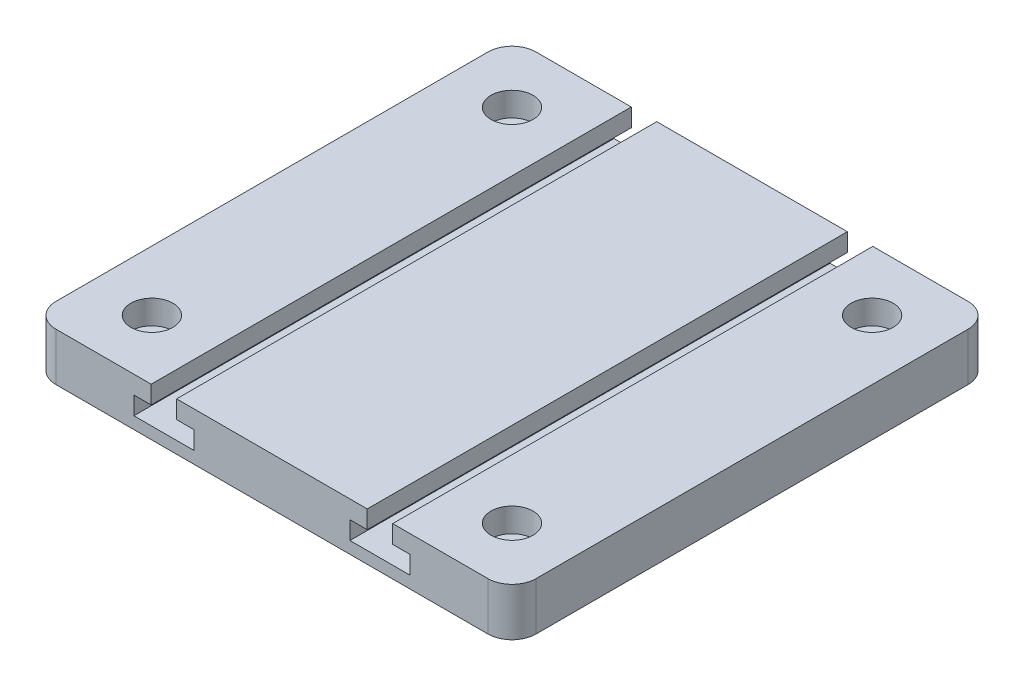
from build123d import *

# Parameters (mm, degrees)
SKETCH1_W                                        = 127
SKETCH1_H                                        = 127
BOSS_EXTRUDE1_DEPTH                              = 12.7
CBORE_FOR_1_4_SOCKET_HEAD_CAP_SCREW1_D           = 6.5278
CBORE_FOR_1_4_SOCKET_HEAD_CAP_SCREW1_CBORE_D     = 11.1125
CBORE_FOR_1_4_SOCKET_HEAD_CAP_SCREW1_CBORE_DEPTH = 6.35
CUT_EXTRUDE1_DEPTH                               = 143.557146436
FILLET1_R                                        = 6.35


with BuildPart() as part:
    # Sketch1 → Boss-Extrude1 (new body)
    with BuildSketch(Plane(origin=(0, 0, 0), x_dir=(1, 0, 0), z_dir=(0, 1, 0))):
        Rectangle(SKETCH1_W, SKETCH1_H)
    extrude(amount=BOSS_EXTRUDE1_DEPTH)

    # CBORE for 1/4 Socket Head Cap Screw1 (through all)
    with Locations(Plane(origin=(0, 12.7, 0), x_dir=(1, 0, 0), z_dir=(0, 1, 0))):
        with Locations((-47.625, 47.625), (47.625, 47.625), (47.625, -47.625), (-47.625, -47.625)):
            CounterBoreHole(CBORE_FOR_1_4_SOCKET_HEAD_CAP_SCREW1_D / 2, CBORE_FOR_1_4_SOCKET_HEAD_CAP_SCREW1_CBORE_D / 2, CBORE_FOR_1_4_SOCKET_HEAD_CAP_SCREW1_CBORE_DEPTH)

    # Sketch4 → Cut-Extrude1 (cut, through all)
    with BuildSketch(Plane.XY.offset(63.5)):
        Polygon((-31.9405, 12.7), (-31.9405, 7.9375), (-36.5125, 7.9375), (-36.5125, 3.175), (-20.6375, 3.175), (-20.6375, 7.9375), (-25.2095, 7.9375), (-25.2095, 12.7), align=None)
        Polygon((25.2095, 7.9375), (25.2095, 12.7), (31.9405, 12.7), (31.9405, 7.9375), (36.5125, 7.9375), (36.5125, 3.175), (20.6375, 3.175), (20.6375, 7.9375), align=None)
    extrude(amount=-CUT_EXTRUDE1_DEPTH, mode=Mode.SUBTRACT)

    # Fillet1
    fillet1_edges = [part.edges().sort_by_distance(p)[0] for p in [
        (-63.5, 6.35, 63.5),
        (63.5, 6.35, 63.5),
        (63.5, 6.35, -63.5),
        (-63.5, 6.35, -63.5),
    ]]
    fillet(fillet1_edges, radius=FILLET1_R)


solid = part.part
